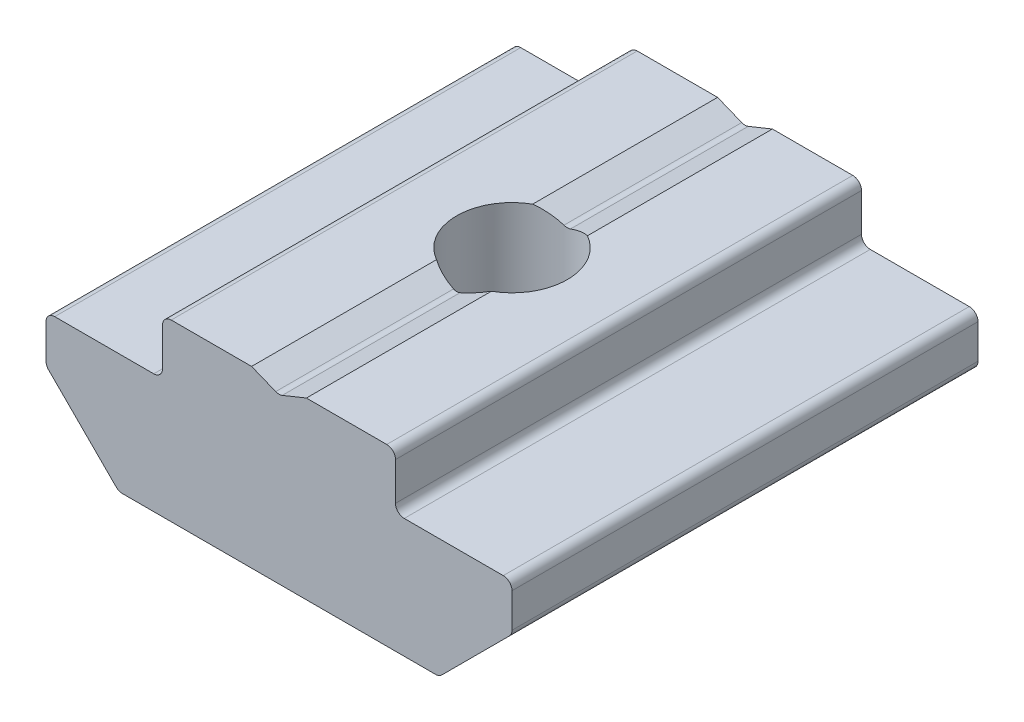
from build123d import *

# Parameters (mm, degrees)
BOSS_EXTRUDE1_DEPTH      = 8
BOSS_EXTRUDE1_DEPTH_BACK = 8
SKETCH9_R                = 1.9
CUT_EXTRUDE2_DEPTH       = 13.806248475
FILLET1_R                = 0.3


with BuildPart() as part:
    # Sketch4 → Boss-Extrude1 (new, two sides: drawn at the far end of the back side and taken through both)
    with BuildSketch(Plane.XY.offset(-BOSS_EXTRUDE1_DEPTH_BACK)):
        Polygon((-8, 4.1), (-8, 2.5), (-5.5, 0), (5.5, 0), (8, 2.5), (8, 4.1), (4, 4.1), (4, 6), (0.940533004, 6), (0, 5.62), (-0.940533004, 6), (-4, 6), (-4, 4.1), align=None)
    extrude(amount=BOSS_EXTRUDE1_DEPTH + BOSS_EXTRUDE1_DEPTH_BACK)

    # Sketch9 → Cut-Extrude2 (cut, through all)
    with BuildSketch(Plane(origin=(0, 0, 0), x_dir=(1, 0, 0), z_dir=(0, 1, 0))):
        with Locations(Location((0, 0, 0), (0, 0, 270))):
            Circle(SKETCH9_R)
    extrude(amount=CUT_EXTRUDE2_DEPTH, mode=Mode.SUBTRACT)

    # Fillet1
    # the kernel refuses this fillet: 0.3 mm, written as the material it adds along each edge
    with BuildSketch(Plane(origin=(-4, 4.1, 8), x_dir=(-1, 0, 0), z_dir=(0, 0, -1)), Plane(origin=(4, 4.1, -8), x_dir=(1, 0, 0), z_dir=(0, 0, 1))) as fillet1_piece_1:
        with BuildLine():
            CenterArc((FILLET1_R, FILLET1_R), FILLET1_R, 180, 90)
            Line((0, FILLET1_R), (0, 0))
            Line((0, 0), (FILLET1_R, 0))
        make_face()
    extrude(amount=16)
    with BuildSketch(Plane(origin=(0, 5.62, -8), x_dir=(0.927183854566788, 0.3746065934159107, 0), z_dir=(0, 0, 1))) as fillet1_piece_2_section:
        with BuildLine():
            CenterArc((FILLET1_R * 0.404026225835, FILLET1_R), FILLET1_R, 226, 44)
            Line((-FILLET1_R * 0.290632144624, FILLET1_R * 0.280660199661), (0, 0))
            Line((0, 0), (FILLET1_R * 0.404026225835, 0))
        make_face()
    fillet1_piece_2 = extrude(amount=6.403019669, mode=Mode.PRIVATE)
    fillet1_piece_2 = fillet1_piece_2 - Plane(origin=(0, 5.639105269, 0), x_dir=(0, 0, 1), z_dir=(0, -1, 0)) * Cylinder(1.9, 14, mode=Mode.PRIVATE)
    add(fillet1_piece_2)
    with BuildSketch(Plane(origin=(0, 5.62, 1.596980331), x_dir=(0.927183854566788, 0.3746065934159107, 0), z_dir=(0, 0, 1))) as fillet1_piece_3_section:
        with BuildLine():
            CenterArc((FILLET1_R * 0.404026225835, FILLET1_R), FILLET1_R, 226, 44)
            Line((-FILLET1_R * 0.290632144624, FILLET1_R * 0.280660199661), (0, 0))
            Line((0, 0), (FILLET1_R * 0.404026225835, 0))
        make_face()
    fillet1_piece_3 = extrude(amount=6.403019669, mode=Mode.PRIVATE)
    fillet1_piece_3 = fillet1_piece_3 - Plane(origin=(0, 5.639105269, 0), x_dir=(0, 0, 1), z_dir=(0, -1, 0)) * Cylinder(1.9, 14, mode=Mode.PRIVATE)
    add(fillet1_piece_3)
    # the kernel refuses this fillet: 0.3 mm, written as the material it takes off along each edge
    with BuildSketch(Plane(origin=(-4, 6, 8.75), x_dir=(1, 0, 0), z_dir=(0, 0, -1))) as fillet1_2_piece_1:
        with BuildLine():
            CenterArc((FILLET1_R, FILLET1_R), FILLET1_R, 180, 90)
            Line((0, FILLET1_R), (0, 0))
            Line((0, 0), (FILLET1_R, 0))
        make_face()
    extrude(amount=17.5, mode=Mode.SUBTRACT)
    with BuildSketch(Plane(origin=(-8, 4.1, 8.75), x_dir=(0, -1, 0), z_dir=(0, 0, -1)), Plane(origin=(8, 4.1, -8.75), x_dir=(0, -1, 0), z_dir=(0, 0, 1)), Plane(origin=(4, 6, -8.75), x_dir=(0, -1, 0), z_dir=(0, 0, 1))) as fillet1_2_piece_2:
        with BuildLine():
            CenterArc((FILLET1_R, -FILLET1_R), FILLET1_R, 90, 90)
            Line((0, -FILLET1_R), (0, 0))
            Line((0, 0), (FILLET1_R, 0))
        make_face()
    extrude(amount=17.5, mode=Mode.SUBTRACT)
    with BuildSketch(Plane(origin=(-8, 2.5, -8.310660172), x_dir=(0, 1, 0), z_dir=(0, 0, 1)), Plane(origin=(-5.5, 0, -8.310660172), x_dir=(-0.7071067811865439, 0.7071067811865512, 0), z_dir=(0, 0, 1)), Plane(origin=(5.5, 0, -8.310660172), x_dir=(-1, 0, 0), z_dir=(0, 0, 1)), Plane(origin=(8, 2.5, -8.310660172), x_dir=(-0.7071067811865492, -0.7071067811865457, 0), z_dir=(0, 0, 1))) as fillet1_2_piece_3:
        with BuildLine():
            CenterArc((FILLET1_R * 0.414213562373, -FILLET1_R), FILLET1_R, 90, 45)
            Line((-FILLET1_R * 0.292893218813, -FILLET1_R * 0.292893218813), (0, 0))
            Line((0, 0), (FILLET1_R * 0.414213562373, 0))
        make_face()
    extrude(amount=16.621320344, mode=Mode.SUBTRACT)


solid = part.part
